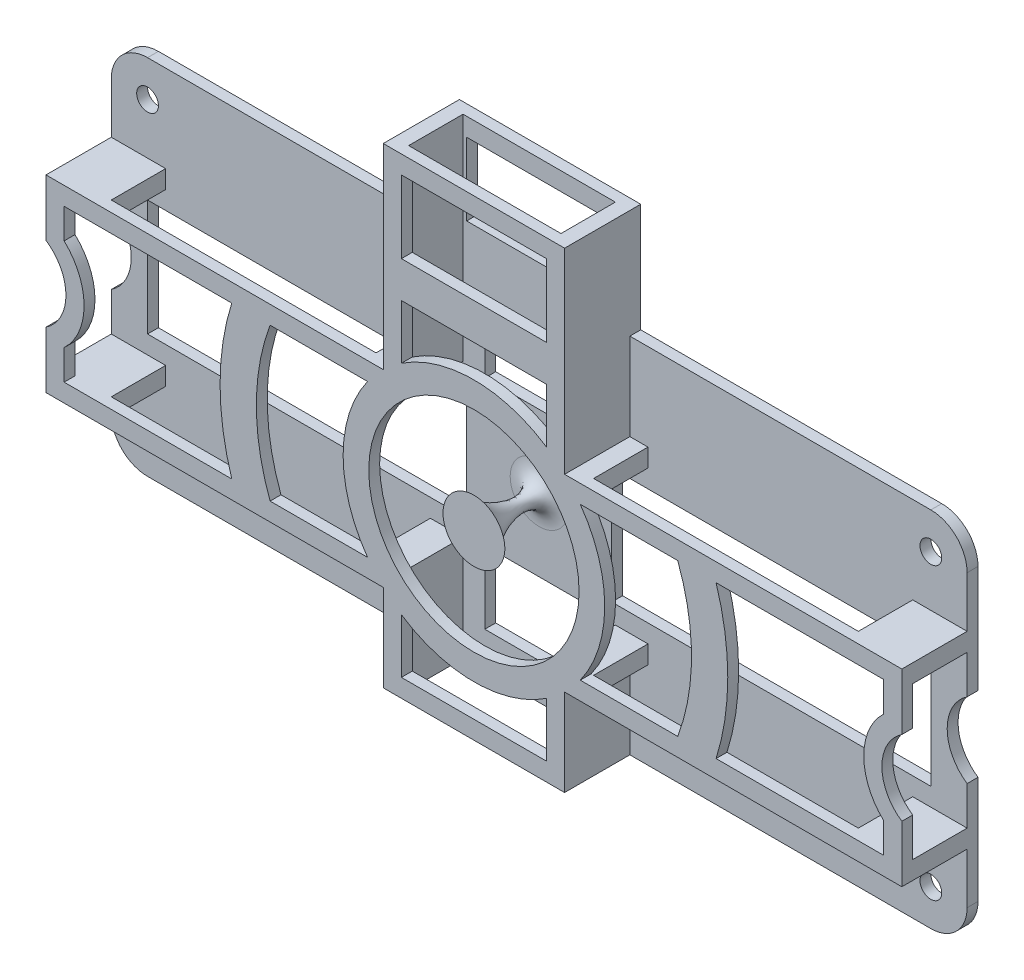
from build123d import *

# Parameters (mm, degrees)
EXTRUDE_1_OUTLINE_R   = 6
EXTRUDE_1_DEPTH       = 21
EXTRUDE_2_OUTLINE_R   = 6
EXTRUDE_2_OUTLINE_R_2 = 3
EXTRUDE_2_DEPTH       = 3
SKETCH_2_W            = 15
SKETCH_2_H            = 42
CUT_EXTRUDE_1_DEPTH   = 243.150779474
SKETCH_3_W            = 42
SKETCH_3_H            = 15
CUT_EXTRUDE_2_DEPTH   = 157.092921044
SKETCH_2_3_W          = 18
SKETCH_2_3_H          = 14
SKETCH_2_3_H_2        = 10
SKETCH_2_3_H_3        = 24
CUT_EXTRUDE_3_DEPTH   = 93
CUT_EXTRUDE_START     = -236
SKETCH_2_4_W          = 15
SKETCH_2_4_H          = 42
SKETCH_2_4_W_2        = 18
SKETCH_2_4_H_2        = 24
CUT_EXTRUDE_4_DEPTH   = 93
SKETCH_3_3_W          = 42
SKETCH_3_3_H          = 15
SKETCH_3_3_W_2        = 73
CUT_EXTRUDE_5_DEPTH   = 157.092921044
CUT_EXTRUDE_6_REACH   = 131.865
SKETCH_6_W            = 88
SKETCH_6_H            = 32
SKETCH_6_W_2          = 30
SKETCH_6_H_2          = 20
CUT_EXTRUDE_7_DEPTH   = 130.414064165
SKETCH_7_R            = 36.069377594
SKETCH_7_R_2          = 29
EXTRUDE_3_DEPTH       = 3
SKETCH_8_W            = 50
SKETCH_8_H            = 21
SKETCH_8_W_2          = 42
SKETCH_8_H_2          = 15
EXTRUDE_4_DEPTH       = 30
SKETCH_9_W            = 40
SKETCH_9_H            = 20
CUT_EXTRUDE_8_DEPTH   = 145.100659263


# Read off the part's stored shape, not the designer's step: 凸台-拉伸1, 凸台-拉伸2
with BuildPart() as part:
    # 凸台-拉伸1 outline → 凸台-拉伸1 (new body)
    with BuildSketch(Plane.XY):
        with BuildLine():
            ThreePointArc((118, 40), (115.071067812, 47.071067812), (108, 50))
            Line((108, 50), (-108, 50))
            ThreePointArc((-108, 50), (-115.071067812, 47.071067812), (-118, 40))
            Line((-118, 40), (-118, 10.356157589))
            ThreePointArc((-118, 10.356157589), (-112.5, 0), (-118, -10.356157589))
            Line((-118, -10.356157589), (-118, -40))
            ThreePointArc((-118, -40), (-115.071067812, -47.071067812), (-108, -50))
            Line((-108, -50), (108, -50))
            ThreePointArc((108, -50), (115.071067812, -47.071067812), (118, -40))
            Line((118, -40), (118, -10.356157589))
            ThreePointArc((118, -10.356157589), (112.5, 0), (118, 10.356157589))
            Line((118, 10.356157589), (118, 40))
        make_face()
        with Locations((-108, -40)):
            Circle(EXTRUDE_1_OUTLINE_R, mode=Mode.SUBTRACT)
        with Locations((108, -40)):
            Circle(EXTRUDE_1_OUTLINE_R, mode=Mode.SUBTRACT)
        with Locations((-108, 40)):
            Circle(EXTRUDE_1_OUTLINE_R, mode=Mode.SUBTRACT)
        with Locations((108, 40)):
            Circle(EXTRUDE_1_OUTLINE_R, mode=Mode.SUBTRACT)
    extrude(amount=EXTRUDE_1_DEPTH)

    # 凸台-拉伸2 outline → 凸台-拉伸2 (add)
    # profile 1 of 4: a face of its own
    with BuildSketch(Plane.XY):
        with Locations((108, -40)):
            Circle(EXTRUDE_2_OUTLINE_R)
        with Locations((108, -40)):
            Circle(EXTRUDE_2_OUTLINE_R_2, mode=Mode.SUBTRACT)
    # profile 2 of 4: a face of its own
    with BuildSketch(Plane.XY):
        with Locations((-108, 40)):
            Circle(EXTRUDE_2_OUTLINE_R)
        with Locations((-108, 40)):
            Circle(EXTRUDE_2_OUTLINE_R_2, mode=Mode.SUBTRACT)
    # profile 3 of 4: a face of its own
    with BuildSketch(Plane.XY):
        with Locations((-108, -40)):
            Circle(EXTRUDE_2_OUTLINE_R)
        with Locations((-108, -40)):
            Circle(EXTRUDE_2_OUTLINE_R_2, mode=Mode.SUBTRACT)
    # profile 4 of 4: a face of its own
    with BuildSketch(Plane.XY):
        with Locations((108, 40)):
            Circle(EXTRUDE_2_OUTLINE_R)
        with Locations((108, 40)):
            Circle(EXTRUDE_2_OUTLINE_R_2, mode=Mode.SUBTRACT)
    extrude(amount=EXTRUDE_2_DEPTH)

    # 草图2 → 切除-拉伸1 (cut, through all)
    with BuildSketch(Plane(origin=(118, 0, 0), x_dir=(0, 0, -1), z_dir=(1, 0, 0))):
        with Locations((-10.5, 0)):
            Rectangle(SKETCH_2_W, SKETCH_2_H)
    extrude(amount=-CUT_EXTRUDE_1_DEPTH, mode=Mode.SUBTRACT)

    # 草图3 → 切除-拉伸2 (cut, through all)
    with BuildSketch(Plane(origin=(0, 50, 0), x_dir=(1, 0, 0), z_dir=(0, 1, 0))):
        with Locations((0, -10.5)):
            Rectangle(SKETCH_3_W, SKETCH_3_H)
    extrude(amount=-CUT_EXTRUDE_2_DEPTH, mode=Mode.SUBTRACT)

    # 草图2<3> → 切除-拉伸3 (cut)
    with BuildSketch(Plane(origin=(118, 0, 0), x_dir=(0, 0, -1), z_dir=(1, 0, 0))):
        with Locations((-12, 33)):
            Rectangle(SKETCH_2_3_W, SKETCH_2_3_H)
        with Locations((-12, 45)):
            Rectangle(SKETCH_2_3_W, SKETCH_2_3_H_2)
        with Locations((-12, -38)):
            Rectangle(SKETCH_2_3_W, SKETCH_2_3_H_3)
    extrude(amount=-CUT_EXTRUDE_3_DEPTH, mode=Mode.SUBTRACT)

    # 草图2<4> → 切除-拉伸4 (cut)
    with BuildSketch(Plane(origin=(118, 0, 0), x_dir=(0, 0, -1), z_dir=(1, 0, 0)).offset(CUT_EXTRUDE_START)):
        with Locations((-10.5, 0)):
            Rectangle(SKETCH_2_4_W, SKETCH_2_4_H)
        with Locations((-12, -38)):
            Rectangle(SKETCH_2_4_W_2, SKETCH_2_4_H_2)
        with Locations((-12, 38)):
            Rectangle(SKETCH_2_4_W_2, SKETCH_2_4_H_2)
    extrude(amount=CUT_EXTRUDE_4_DEPTH, mode=Mode.SUBTRACT)

    # 草图3<3> → 切除-拉伸5 (cut, through all)
    with BuildSketch(Plane(origin=(0, 50, 0), x_dir=(1, 0, 0), z_dir=(0, 1, 0))):
        with Locations((0, -10.5)):
            Rectangle(SKETCH_3_3_W, SKETCH_3_3_H)
        with Locations((-66.5, -10.5)):
            Rectangle(SKETCH_3_3_W_2, SKETCH_3_3_H)
        with Locations((66.5, -10.5)):
            Rectangle(SKETCH_3_3_W_2, SKETCH_3_3_H)
    extrude(amount=-CUT_EXTRUDE_5_DEPTH, mode=Mode.SUBTRACT)

    # 草图4 → 切除-拉伸6 (cut, up to next)
    with BuildSketch(Plane.XY.offset(21), mode=Mode.PRIVATE) as cut_extrude_6_sk1:
        with BuildLine():
            Line((-113, -12.737739203), (-113, -21))
            Line((-113, -21), (-20, -21))
            Line((-20, -21), (-20, -45))
            Line((-20, -45), (20, -45))
            Line((20, -45), (20, -21))
            Line((20, -21), (113, -21))
            Line((113, -21), (113, -12.737739203))
            ThreePointArc((113, -12.737739203), (107.5, 0), (113, 12.737739203))
            Line((113, 12.737739203), (113, 21))
            Line((113, 21), (20, 21))
            Line((20, 21), (20, 45))
            Line((20, 45), (-20, 45))
            Line((-20, 45), (-20, 21))
            Line((-20, 21), (-113, 21))
            Line((-113, 21), (-113, 12.737739203))
            ThreePointArc((-113, 12.737739203), (-107.5, 0), (-113, -12.737739203))
        make_face()
    cut_extrude_6_tool1 = extrude(cut_extrude_6_sk1.sketch, amount=-CUT_EXTRUDE_6_REACH, mode=Mode.PRIVATE) & part.part
    add(cut_extrude_6_tool1.solids().sort_by_distance((0, 0, 21))[0], mode=Mode.SUBTRACT)

    # 草图5 → 旋转1 (revolve)
    with BuildSketch(Plane.XZ):
        with BuildLine():
            Line((-8, 3), (0, 3))
            Line((0, 3), (0, 21))
            Line((0, 21), (-8.520929424, 21))
            add(Edge.make_bspline(
                [(-8, 3), (4.290492331, 3.04061628), (-4.734637162, 21), (-8.520929424, 21)],
                knots=[0, 0, 0, 0, 1, 1, 1, 1], degree=3))
        make_face()
    revolve(axis=Axis((0, 0, 0), (0, 0, 1)))

    # 草图6 → 切除-拉伸7 (cut, through all)
    with BuildSketch(Plane.XY.offset(3)):
        with Locations((-64, 0)):
            Rectangle(SKETCH_6_W, SKETCH_6_H)
        with Locations((0, 30)):
            Rectangle(SKETCH_6_W_2, SKETCH_6_H_2)
        with Locations((64, 0)):
            Rectangle(SKETCH_6_W, SKETCH_6_H)
        with Locations((0, -30)):
            Rectangle(SKETCH_6_W_2, SKETCH_6_H_2)
    extrude(amount=-CUT_EXTRUDE_7_DEPTH, mode=Mode.SUBTRACT)

    # 草图7 → 凸台-拉伸3 (add)
    # profile 1 of 3: a face of its own
    with BuildSketch(Plane.XY.offset(21)):
        Circle(SKETCH_7_R)
        Circle(SKETCH_7_R_2, mode=Mode.SUBTRACT)
    # profile 2 of 3: a face of its own
    with BuildSketch(Plane.XY.offset(21)):
        with BuildLine():
            Line((-64.992307237, 26), (-54.074023338, 26))
            ThreePointArc((-54.074023338, 26), (-60, 0), (-54.074023338, -26))
            Line((-54.074023338, -26), (-64.992307237, -26))
            ThreePointArc((-64.992307237, -26), (-70, 0), (-64.992307237, 26))
        make_face()
    # profile 3 of 3: a face of its own
    with BuildSketch(Plane.XY.offset(21)):
        with BuildLine():
            Line((64.992307237, 26), (54.074023338, 26))
            ThreePointArc((54.074023338, 26), (60, 0), (54.074023338, -26))
            Line((54.074023338, -26), (64.992307237, -26))
            ThreePointArc((64.992307237, -26), (70, 0), (64.992307237, 26))
        make_face()
    extrude(amount=-EXTRUDE_3_DEPTH)

    # 草图8 → 凸台-拉伸4 (add)
    with BuildSketch(Plane(origin=(0, 50, 0), x_dir=(1, 0, 0), z_dir=(0, 1, 0))):
        with Locations((0, -10.5)):
            Rectangle(SKETCH_8_W, SKETCH_8_H)
        with Locations((0, -10.5)):
            Rectangle(SKETCH_8_W_2, SKETCH_8_H_2, mode=Mode.SUBTRACT)
    extrude(amount=EXTRUDE_4_DEPTH)

    # 草图9 → 切除-拉伸8 (cut, through all)
    with BuildSketch(Plane.XY.offset(21)):
        with Locations((0, 65)):
            Rectangle(SKETCH_9_W, SKETCH_9_H)
    extrude(amount=-CUT_EXTRUDE_8_DEPTH, mode=Mode.SUBTRACT)


solid = part.part
